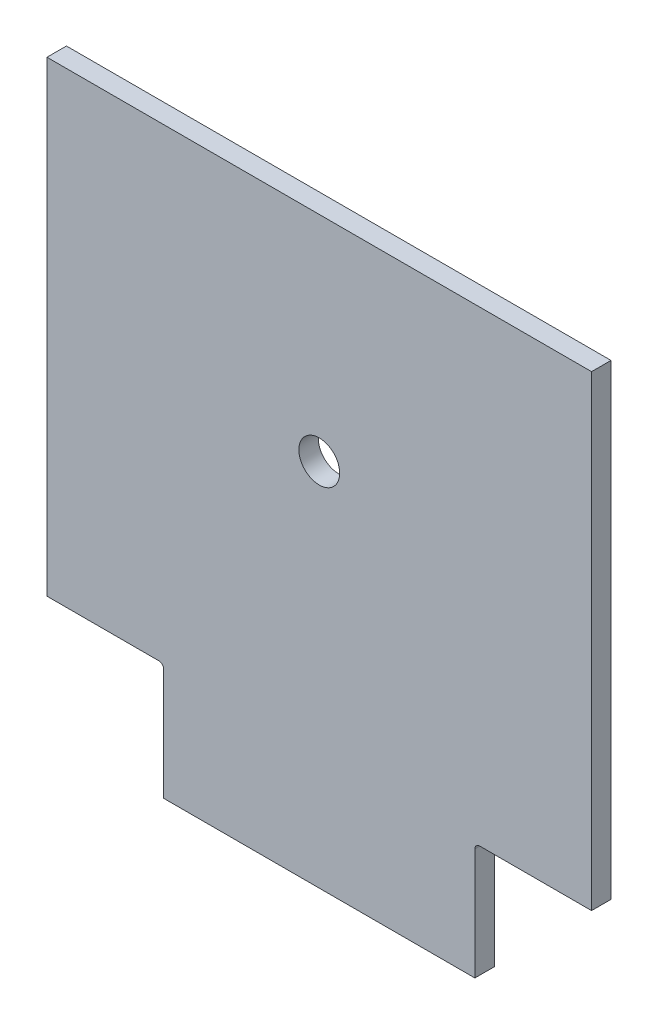
from build123d import *

# Parameters (mm, degrees)
BOSS_EXTRUDE1_DEPTH = 6.35
SKETCH3_W           = 203.2
SKETCH3_H           = 12.7
BOSS_EXTRUDE2_DEPTH = 76.2
CAVITY1_START       = -6.35
CAVITY1_OUTLINE_R   = 12.7
CAVITY1_DEPTH       = 12.7
MOVE_FACE_HOLE_BY   = 0.635
SLOT_FILLET_R       = 3.175


# Read off the part's stored shape, not the designer's step: Cavity1
with BuildPart() as part:
    # Sketch1 → Boss-Extrude1 (new, symmetric)
    with BuildSketch(Plane.XY):
        Polygon((732.36, 381), (785.7, 381), (1001.6, 381), (1087.96, 381), (1087.96, 685.8), (1001.6, 685.8), (785.7, 685.8), (732.36, 685.8), align=None)
    extrude(amount=BOSS_EXTRUDE1_DEPTH, both=True)

    # Sketch3 → Boss-Extrude2 (add)
    with BuildSketch(Plane.XZ.offset(-381)):
        with Locations((910.16, 0)):
            Rectangle(SKETCH3_W, SKETCH3_H)
    extrude(amount=BOSS_EXTRUDE2_DEPTH)

    # Cavity1 outline → Cavity1 (cut)
    with BuildSketch(Plane.XY.offset(CAVITY1_START)):
        with Locations((910.16, 546.1)):
            Circle(CAVITY1_OUTLINE_R)
    extrude(amount=CAVITY1_DEPTH, mode=Mode.SUBTRACT)

    # Move Face Hole: a curved face moved inward by 0.635
    add(Solid.thicken(part.faces().sort_by_distance((897.46, 546.1, 0))[0], -MOVE_FACE_HOLE_BY), mode=Mode.SUBTRACT)

    # Slot Fillet
    slot_fillet_edges = [part.edges().sort_by_distance(p)[0] for p in [
        (808.56, 381, 0),
        (1011.76, 381, 0),
    ]]
    fillet(slot_fillet_edges, radius=SLOT_FILLET_R)


solid = part.part
